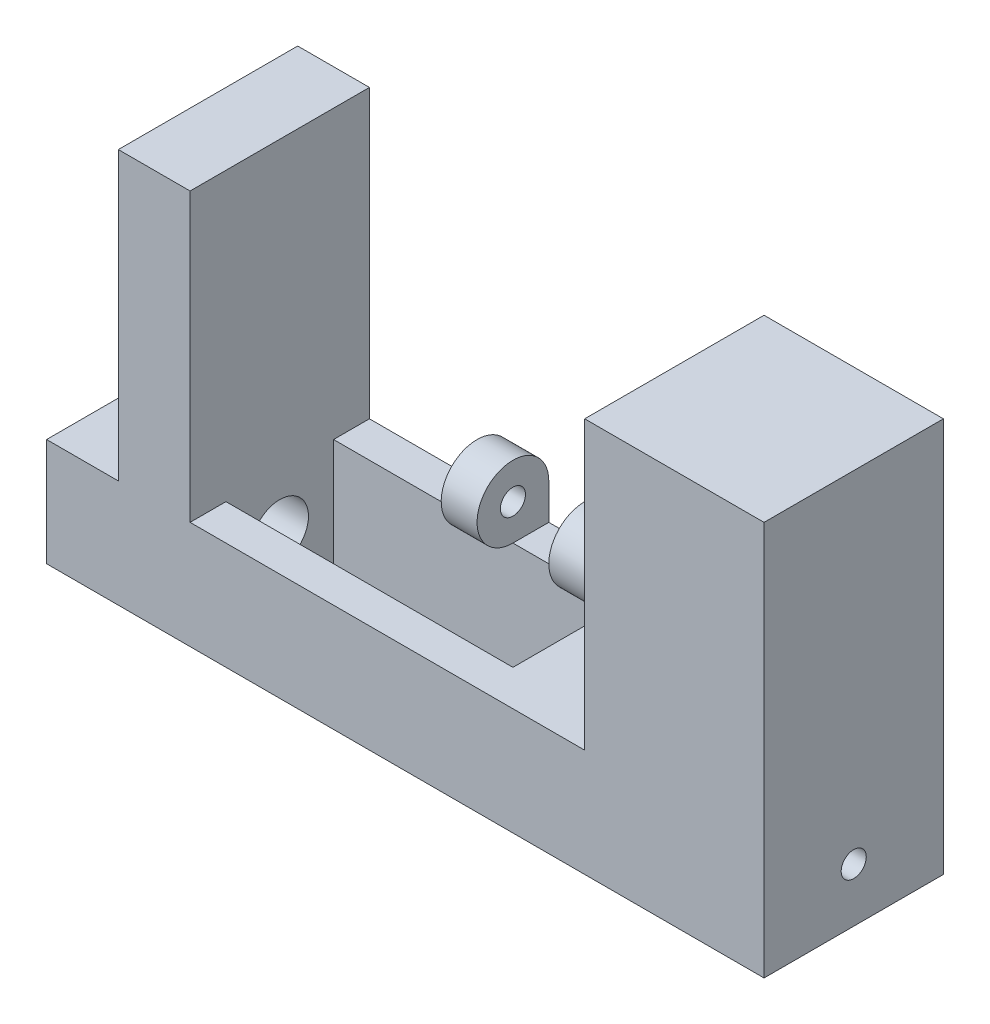
from build123d import *

# Parameters (mm, degrees)
SKETCH2_W                            = 100
SKETCH2_H                            = 25
SKETCH2_W_2                          = 40
SKETCH2_H_2                          = 15
BOSS_EXTRUDE1_DEPTH                  = 15
CUT_EXTRUDE1_REACH                   = 103.888
SKETCH3_R                            = 1.75
CUT_EXTRUDE2_REACH                   = 103.888
SKETCH4_R                            = 4
F_3_2_3_2_DIAMETER_HOLE1_D           = 3.2
F_3_2_3_2_DIAMETER_HOLE1_CSINK_D     = 3.25
F_3_2_3_2_DIAMETER_HOLE1_CSINK_ANGLE = 90
SKETCH8_W                            = 10
SKETCH8_H                            = 25
SKETCH8_W_2                          = 25
BOSS_EXTRUDE2_DEPTH                  = 40
SKETCH9_R                            = 1.75
BOSS_EXTRUDE3_DEPTH                  = 40
CUT_EXTRUDE3_REACH                   = 75.186
SKETCH10_W                           = 20
SKETCH10_H                           = 10
SKETCH10_W_2                         = 10


with BuildPart() as part:
    # Sketch2 → Boss-Extrude1 (new body)
    with BuildSketch(Plane(origin=(0, 0, 0), x_dir=(1, 0, 0), z_dir=(0, 1, 0))):
        with Locations((10, 0)):
            Rectangle(SKETCH2_W, SKETCH2_H)
        Rectangle(SKETCH2_W_2, SKETCH2_H_2, mode=Mode.SUBTRACT)
    extrude(amount=BOSS_EXTRUDE1_DEPTH)

    # Sketch3 → Cut-Extrude1 (cut, up to next)
    with BuildSketch(Plane(origin=(60, 0, 0), x_dir=(0, 0, -1), z_dir=(1, 0, 0)), mode=Mode.PRIVATE) as cut_extrude1_sk1:
        with Locations((0, 7.5)):
            Circle(SKETCH3_R)
    cut_extrude1_tool1 = extrude(cut_extrude1_sk1.sketch, amount=-CUT_EXTRUDE1_REACH, mode=Mode.PRIVATE) & part.part
    add(cut_extrude1_tool1.solids().sort_by_distance((60, 7.5, 0))[0], mode=Mode.SUBTRACT)

    # Sketch4 → Cut-Extrude2 (cut, up to next)
    with BuildSketch(Plane.ZY.offset(40), mode=Mode.PRIVATE) as cut_extrude2_sk1:
        with Locations((0, 7.5)):
            Circle(SKETCH4_R)
    cut_extrude2_tool1 = extrude(cut_extrude2_sk1.sketch, amount=-CUT_EXTRUDE2_REACH, mode=Mode.PRIVATE) & part.part
    add(cut_extrude2_tool1.solids().sort_by_distance((-40, 7.5, 0))[0], mode=Mode.SUBTRACT)

    # Ø3.2 (3.2) Diameter Hole1 (through all)
    with Locations(Plane(origin=(0, 15, 0), x_dir=(1, 0, 0), z_dir=(0, 1, 0))):
        with Locations((-35, 0)):
            CounterSinkHole(F_3_2_3_2_DIAMETER_HOLE1_D / 2, F_3_2_3_2_DIAMETER_HOLE1_CSINK_D / 2, counter_sink_angle=F_3_2_3_2_DIAMETER_HOLE1_CSINK_ANGLE)

    # Sketch8 → Boss-Extrude2 (add)
    with BuildSketch(Plane(origin=(0, 15, 0), x_dir=(1, 0, 0), z_dir=(0, 1, 0))):
        with Locations((-25, 0)):
            Rectangle(SKETCH8_W, SKETCH8_H)
        with Locations((47.5, 0)):
            Rectangle(SKETCH8_W_2, SKETCH8_H)
    extrude(amount=BOSS_EXTRUDE2_DEPTH)

    # Sketch9 → Boss-Extrude3 (add)
    with BuildSketch(Plane(origin=(-20, 0, 0), x_dir=(0, 0, -1), z_dir=(1, 0, 0))):
        with BuildLine():
            Line((12.5, 20), (12.5, 15))
            Line((12.5, 15), (7.5, 15))
            ThreePointArc((7.5, 15), (3.964466094, 23.535533906), (12.5, 20))
        make_face()
        with Locations((7.5, 20)):
            Circle(SKETCH9_R, mode=Mode.SUBTRACT)
    extrude(amount=BOSS_EXTRUDE3_DEPTH)

    # Sketch10 → Cut-Extrude3 (cut, up to next)
    with BuildSketch(Plane(origin=(0, 15, 0), x_dir=(1, 0, 0), z_dir=(0, 1, 0)), mode=Mode.PRIVATE) as cut_extrude3_sk1:
        with Locations((-10, 7.5)):
            Rectangle(SKETCH10_W, SKETCH10_H)
    cut_extrude3_tool1 = extrude(cut_extrude3_sk1.sketch, amount=CUT_EXTRUDE3_REACH, mode=Mode.PRIVATE) & part.part
    # Sketch10 → Cut-Extrude3 (cut, up to next)
    with BuildSketch(Plane(origin=(0, 15, 0), x_dir=(1, 0, 0), z_dir=(0, 1, 0)), mode=Mode.PRIVATE) as cut_extrude3_sk2:
        with Locations((10, 7.5)):
            Rectangle(SKETCH10_W_2, SKETCH10_H)
    cut_extrude3_tool2 = extrude(cut_extrude3_sk2.sketch, amount=CUT_EXTRUDE3_REACH, mode=Mode.PRIVATE) & part.part
    add(cut_extrude3_tool1.solids().sort_by_distance((-10, 15, -7.5))[0], mode=Mode.SUBTRACT)
    add(cut_extrude3_tool2.solids().sort_by_distance((10, 15, -7.5))[0], mode=Mode.SUBTRACT)


solid = part.part
